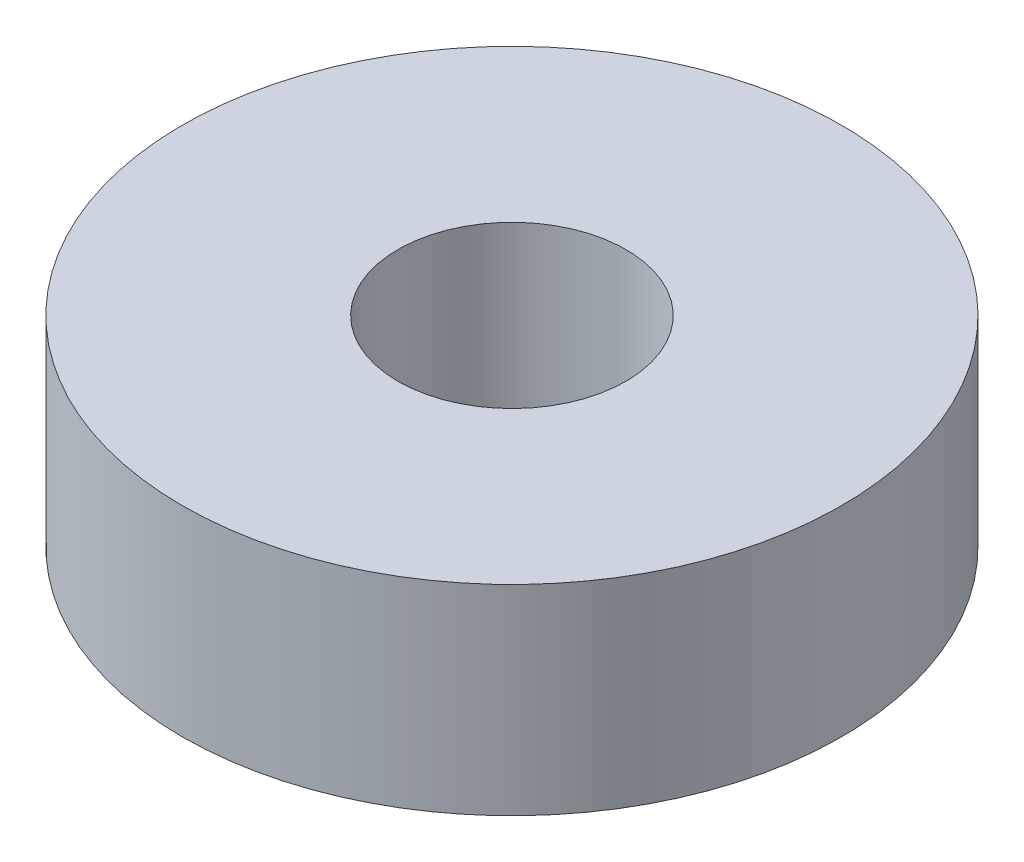
from build123d import *

# Parameters (mm, degrees)
SKETCH1_R           = 13
SKETCH1_R_2         = 4.5
BOSS_EXTRUDE1_DEPTH = 7.9


with BuildPart() as part:
    # Sketch1 → Boss-Extrude1 (new body)
    with BuildSketch(Plane(origin=(0, 0, 0), x_dir=(1, 0, 0), z_dir=(0, 1, 0))):
        Circle(SKETCH1_R)
        Circle(SKETCH1_R_2, mode=Mode.SUBTRACT)
    extrude(amount=BOSS_EXTRUDE1_DEPTH)


solid = part.part
